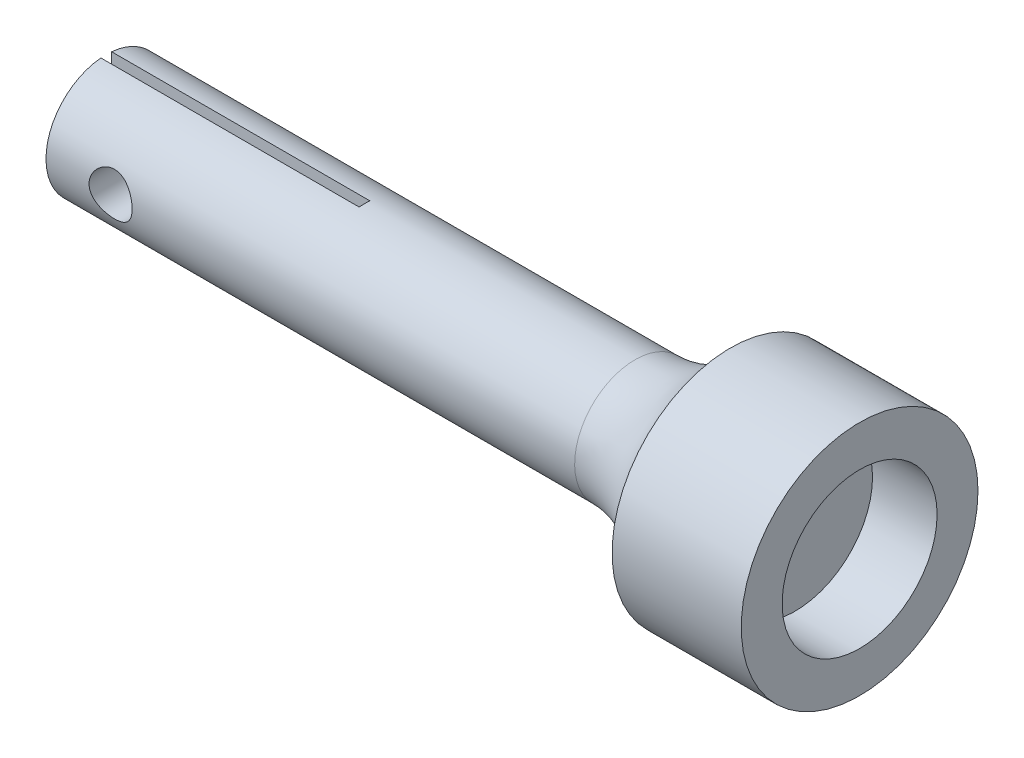
from build123d import *

# Parameters (mm, degrees)
SKETCH_1_R               = 2.8
EXTRUDE_1_DEPTH          = 35
SKETCH_2_W               = 0.5
SKETCH_2_H               = 5.450532248
CUT_EXTRUDE_1_DEPTH      = 12
CUT_EXTRUDE_2_DEPTH      = 10
CUT_EXTRUDE_2_DEPTH_BACK = 10
SKETCH_3_R               = 1
SKETCH_4_R               = 5.5
EXTRUDE_2_DEPTH          = 6
SKETCH_5_R               = 3.6
CUT_EXTRUDE_3_DEPTH      = 3
FILLET_1_R               = 5


with BuildPart() as part:
    # 草图1 → 凸台-拉伸1 (new body)
    with BuildSketch(Plane(origin=(0, 0, 0), x_dir=(0, 0, -1), z_dir=(1, 0, 0))):
        Circle(SKETCH_1_R)
    extrude(amount=EXTRUDE_1_DEPTH)

    # 草图2 → 切除-拉伸1 (cut)
    with BuildSketch(Plane.ZY):
        with Locations((0, 0.396255312)):
            Rectangle(SKETCH_2_W, SKETCH_2_H)
    extrude(amount=-CUT_EXTRUDE_1_DEPTH, mode=Mode.SUBTRACT)

    # 草图3 → 切除-拉伸2 (cut, two sides: drawn at the far end of the back side and taken through both)
    with BuildSketch(Plane(origin=(0, 0, 0.25), x_dir=(-1, 0, 0), z_dir=(0, 0, -1)).offset(-CUT_EXTRUDE_2_DEPTH_BACK)):
        with Locations(Location((-3, -0.005591523, 0), (0, 0, 270))):
            Circle(SKETCH_3_R)
    extrude(amount=CUT_EXTRUDE_2_DEPTH + CUT_EXTRUDE_2_DEPTH_BACK, mode=Mode.SUBTRACT)

    # 草图4 → 凸台-拉伸2 (add)
    with BuildSketch(Plane(origin=(35, 0, 0), x_dir=(0, 0, -1), z_dir=(1, 0, 0))):
        Circle(SKETCH_4_R)
    extrude(amount=-EXTRUDE_2_DEPTH)

    # 草图5 → 切除-拉伸3 (cut)
    with BuildSketch(Plane(origin=(35, 0, 0), x_dir=(0, 0, -1), z_dir=(1, 0, 0))):
        Circle(SKETCH_5_R)
    extrude(amount=-CUT_EXTRUDE_3_DEPTH, mode=Mode.SUBTRACT)

    # 圆角1
    # the kernel refuses this fillet: 5 mm, written as the material it adds along each edge
    with BuildSketch(Plane(origin=(29, 0, 0), x_dir=(0, 0, -1), z_dir=(0, 1, 0))) as fillet_1_piece_1:
        with BuildLine():
            CenterArc((7.8, 4.439594576), FILLET_1_R, 180, 62.612892497)
            Line((5.5, 0), (5.454, -0.088791892))
            ThreePointArc((5.454, -0.088791892), (4.15, -0.1), (2.8, -0.1))
            Line((2.8, -0.1), (2.7, 0))
            Line((2.7, 0), (2.7, 4.439594576))
            Line((2.7, 4.439594576), (2.8, 4.439594576))
        make_face()
    revolve(axis=Axis((29, 0, 0), (-1, 0, 0)))


solid = part.part
